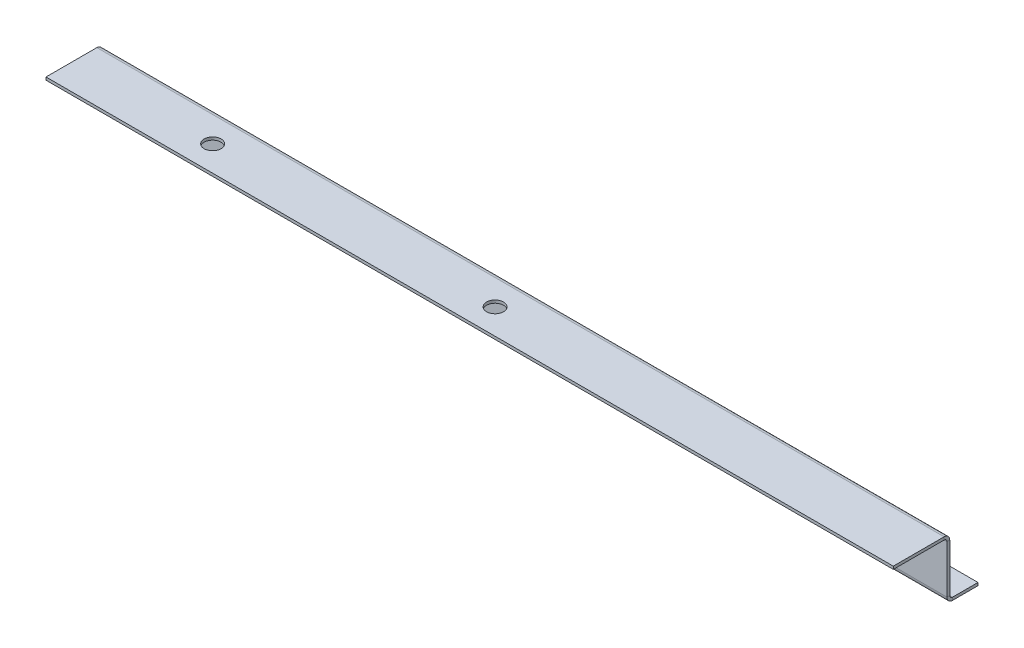
from build123d import *

# Parameters (mm, degrees)
BASE_FLANGE1_DEPTH      = 300
CUT_EXTRUDE1_DEPTH      = 303.226736077
CUT_EXTRUDE1_DEPTH_BACK = 303.226736077
SKETCH7_R               = 3


# Sheet-metal steps are written as plain solids
with BuildPart() as part:
    # Sketch2 → Base-Flange1 (new body)
    with BuildSketch(Plane(origin=(0, 0, 0), x_dir=(0, 0, -1), z_dir=(1, 0, 0))):
        with BuildLine():
            Line((0, 0), (18, 0))
            ThreePointArc((18, 0), (19.414213562, -0.585786438), (20, -2))
            Line((20, -2), (20, -19))
            ThreePointArc((20, -19), (20.292893219, -19.707106781), (21, -20))
            Line((21, -20), (30, -20))
            Line((30, -20), (30, -21))
            Line((30, -21), (21, -21))
            ThreePointArc((21, -21), (19.585786438, -20.414213562), (19, -19))
            Line((19, -19), (19, -2))
            ThreePointArc((19, -2), (18.707106781, -1.292893219), (18, -1))
            Line((18, -1), (0, -1))
            Line((0, -1), (0, 0))
        make_face()
    extrude(amount=BASE_FLANGE1_DEPTH)

    # Sketch7 → Cut-Extrude1 (cut, two sides: drawn at the far end of the back side and taken through both)
    with BuildSketch(Plane(origin=(0, 0, 0), x_dir=(1, 0, 0), z_dir=(0, 1, 0)).offset(-CUT_EXTRUDE1_DEPTH_BACK)):
        with Locations(Location((50, 9, 0), (0, 0, 270))):
            Circle(SKETCH7_R)
        with Locations(Location((150, 9, 0), (0, 0, 270))):
            Circle(SKETCH7_R)
    extrude(amount=CUT_EXTRUDE1_DEPTH + CUT_EXTRUDE1_DEPTH_BACK, mode=Mode.SUBTRACT)


solid = part.part
